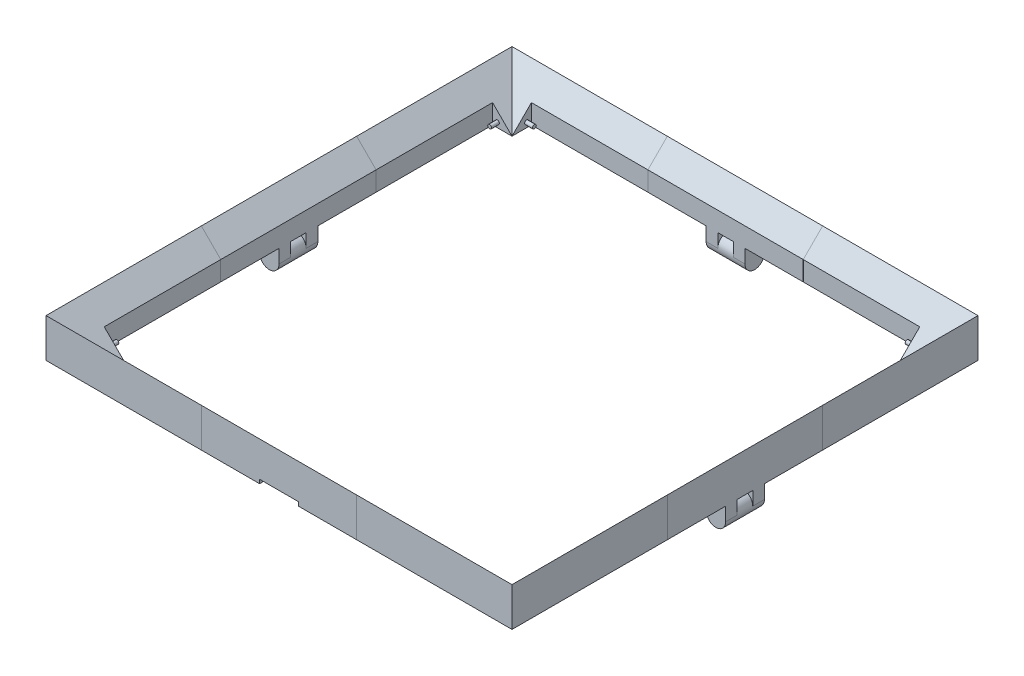
from build123d import *

# Parameters (mm, degrees)
SKETCH1_W                                  = 700
SKETCH1_H                                  = 700
SKETCH1_W_2                                = 500
SKETCH1_H_2                                = 500
BOSS_EXTRUDE2_DEPTH                        = 50
BOSS_EXTRUDE2_DRAFT                        = 45
SKETCH6_W                                  = 700
SKETCH6_H                                  = 700
SKETCH6_W_2                                = 600
SKETCH6_H_2                                = 600
CUT_EXTRUDE1_DEPTH                         = 50
CUT_EXTRUDE2_DEPTH                         = 25
SKETCH8_R                                  = 2.5
BOSS_EXTRUDE3_DEPTH                        = 10
MIRROR1_AT_THE_SECOND_PLANE_COPY_1_SKETC_R = 2.5
MIRROR1_AT_THE_SECOND_PLANE_COPY_1_DEPTH   = 10
MIRROR2_COPY_1_SKETCH_R                    = 2.5
MIRROR2_COPY_1_DEPTH                       = 10
MIRROR2_COPY_2_SKETCH_R                    = 2.5
MIRROR2_COPY_2_DEPTH                       = 10
MIRROR2_COPY_3_SKETCH_R                    = 2.5
MIRROR2_COPY_3_DEPTH                       = 10
SKETCH9_W                                  = 25
SKETCH9_H                                  = 15
BOSS_EXTRUDE4_DEPTH                        = 30
SKETCH11_R                                 = 12.5
BOSS_EXTRUDE5_DEPTH                        = 50
FILLET1_R                                  = 12.5
FILLET1_OF_MIRROR3_R                       = 12.5
MIRROR4_START                              = -25
MIRROR4_OUTLINE_R                          = 12.5
MIRROR4_DEPTH                              = 50
MIRROR4_2_DEPTH                            = 15
MIRROR4_START_2                            = 10
MIRROR4_3_DEPTH                            = 15
INTERSECT1_START                           = -300
INTERSECT1_DEPTH                           = 200
INTERSECT1_2_DEPTH                         = 50
INTERSECT1_START_2                         = -250
INTERSECT1_3_OUTLINE_R                     = 2.5
INTERSECT1_3_DEPTH                         = 10
INTERSECT1_4_DEPTH                         = 200
INTERSECT1_START_3                         = -279.452
INTERSECT1_5_DEPTH                         = 29.452
INTERSECT1_6_OUTLINE_R                     = 2.5
INTERSECT1_6_DEPTH                         = 10
INTERSECT1_7_DEPTH                         = 600
INTERSECT1_8_DEPTH                         = 200
INTERSECT1_START_4                         = 100
INTERSECT1_9_DEPTH                         = 200
INTERSECT1_START_5                         = -100
INTERSECT1_10_DEPTH                        = 200
INTERSECT1_START_6                         = -25
INTERSECT1_11_OUTLINE_R                    = 12.5
INTERSECT1_11_DEPTH                        = 50
INTERSECT1_12_DEPTH                        = 15
INTERSECT1_START_7                         = 10
INTERSECT1_13_DEPTH                        = 15
INTERSECT1_14_DEPTH                        = 200
INTERSECT1_START_8                         = 250
INTERSECT1_15_DEPTH                        = 50
INTERSECT1_START_9                         = 240
INTERSECT1_16_OUTLINE_R                    = 2.5
INTERSECT1_16_DEPTH                        = 10
INTERSECT1_17_DEPTH                        = 200
INTERSECT1_START_10                        = -280.548
INTERSECT1_18_DEPTH                        = 30.548
INTERSECT1_19_OUTLINE_R                    = 2.5
INTERSECT1_19_DEPTH                        = 10
INTERSECT1_20_DEPTH                        = 200
INTERSECT1_21_OUTLINE_R                    = 12.5
INTERSECT1_21_DEPTH                        = 50
INTERSECT1_22_DEPTH                        = 15
INTERSECT1_23_DEPTH                        = 15
INTERSECT1_24_DEPTH                        = 200
INTERSECT1_25_OUTLINE_R                    = 12.5
INTERSECT1_25_DEPTH                        = 50
INTERSECT1_26_DEPTH                        = 15
INTERSECT1_27_DEPTH                        = 15
INTERSECT1_28_DEPTH                        = 200
INTERSECT1_29_DEPTH                        = 50
INTERSECT1_30_OUTLINE_R                    = 2.5
INTERSECT1_30_DEPTH                        = 10
INTERSECT1_31_DEPTH                        = 200
INTERSECT1_32_DEPTH                        = 30.548
INTERSECT1_33_OUTLINE_R                    = 2.5
INTERSECT1_33_DEPTH                        = 10
INTERSECT1_34_DEPTH                        = 200
INTERSECT1_35_DEPTH                        = 50
INTERSECT1_36_OUTLINE_R                    = 2.5
INTERSECT1_36_DEPTH                        = 10
INTERSECT1_37_DEPTH                        = 200
INTERSECT1_38_DEPTH                        = 30.548
INTERSECT1_39_OUTLINE_R                    = 2.5
INTERSECT1_39_DEPTH                        = 10
SKETCH20_W                                 = 50
SKETCH20_H                                 = 35
CUT_EXTRUDE3_DEPTH                         = 100


with BuildPart() as part:
    # Sketch1 → Boss-Extrude2 (with draft: the straight prism first)
    with BuildSketch(Plane(origin=(0, 0, 0), x_dir=(1, 0, 0), z_dir=(0, 1, 0))):
        Rectangle(SKETCH1_W, SKETCH1_H)
        Rectangle(SKETCH1_W_2, SKETCH1_H_2, mode=Mode.SUBTRACT)
    extrude(amount=BOSS_EXTRUDE2_DEPTH)
    # Boss-Extrude2: the draft: its side faces are tilted about the plane it starts from
    boss_extrude2_sides = [part.faces().sort_by_distance(p)[0] for p in [
        (-350, 25, 0),
        (0, 25, 350),
        (350, 25, 0),
        (0, 25, -350),
        (250, 25, 0),
        (0, 25, 250),
        (-250, 25, 0),
        (0, 25, -250),
    ]]
    draft(boss_extrude2_sides, Plane(origin=(0, 0, 0), x_dir=(1, 0, 0), z_dir=(0, 1, 0)), BOSS_EXTRUDE2_DRAFT)

    # Sketch6 → Cut-Extrude1 (cut)
    with BuildSketch(Plane(origin=(0, 50, 0), x_dir=(1, 0, 0), z_dir=(0, 1, 0))):
        Rectangle(SKETCH6_W, SKETCH6_H)
        Rectangle(SKETCH6_W_2, SKETCH6_H_2, mode=Mode.SUBTRACT)
    extrude(amount=-CUT_EXTRUDE1_DEPTH, mode=Mode.SUBTRACT)

    # Sketch7 → Cut-Extrude2 (cut)
    with BuildSketch(Plane.XZ):
        Polygon((-275, 250), (-250, 250), (-250, 275), (250, 275), (250, 250), (275, 250), (275, -250), (250, -250), (250, -275), (-250, -275), (-250, -250), (-275, -250), align=None)
    extrude(amount=-CUT_EXTRUDE2_DEPTH, mode=Mode.SUBTRACT)

    # Sketch8 → Boss-Extrude3 (add)
    with BuildSketch(Plane.XY.offset(-250)):
        with Locations(Location((-268.75, 6.25, 0), (0, 0, 180))):
            Circle(SKETCH8_R)
    boss_extrude3 = extrude(amount=BOSS_EXTRUDE3_DEPTH)

    # Mirror1: Boss-Extrude3 across plane
    add(boss_extrude3.mirror(Plane(origin=(0, 0, 0), x_dir=(0, 0, 1), z_dir=(1, 0, 0))))

    # Mirror1 at the second plane: Boss-Extrude3 across plane
    add(boss_extrude3.mirror(Plane.XY))

    # Mirror1 at the second plane copy 1 sketc → Mirror1 at the second plane copy 1 (add)
    with BuildSketch(Plane(origin=(0, 0, 250), x_dir=(-1, 0, 0), z_dir=(0, 0, -1))):
        with Locations(Location((-268.75, 6.25, 0), (0, 0, 180))):
            Circle(MIRROR1_AT_THE_SECOND_PLANE_COPY_1_SKETC_R)
    extrude(amount=MIRROR1_AT_THE_SECOND_PLANE_COPY_1_DEPTH)

    # Mirror2: Boss-Extrude3 across plane
    add(boss_extrude3.mirror(Plane(origin=(0, 0, 0), x_dir=(0.7071067811865477, 0, 0.7071067811865474), z_dir=(-0.7071067811865474, 0, 0.7071067811865477))))

    # Mirror2 copy 1 sketch → Mirror2 copy 1 (add)
    with BuildSketch(Plane(origin=(-250, 0, 0), x_dir=(0, 0, -1), z_dir=(1, 0, 0))):
        with Locations(Location((-268.75, 6.25, 0), (0, 0, 180))):
            Circle(MIRROR2_COPY_1_SKETCH_R)
    extrude(amount=MIRROR2_COPY_1_DEPTH)

    # Mirror2 copy 2 sketch → Mirror2 copy 2 (add)
    with BuildSketch(Plane.ZY.offset(-250)):
        with Locations(Location((-268.75, 6.25, 0), (0, 0, 180))):
            Circle(MIRROR2_COPY_2_SKETCH_R)
    extrude(amount=MIRROR2_COPY_2_DEPTH)

    # Mirror2 copy 3 sketch → Mirror2 copy 3 (add)
    with BuildSketch(Plane(origin=(250, 0, 0), x_dir=(0, 0, -1), z_dir=(-1, 0, 0))):
        with Locations((-268.75, -6.25)):
            Circle(MIRROR2_COPY_3_SKETCH_R)
    extrude(amount=MIRROR2_COPY_3_DEPTH)

    # Sketch9 → Boss-Extrude4 (add)
    with BuildSketch(Plane.XZ):
        with Locations((-287.5, 17.5)):
            Rectangle(SKETCH9_W, SKETCH9_H)
        with Locations((-287.5, -17.5)):
            Rectangle(SKETCH9_W, SKETCH9_H)
    boss_extrude4 = extrude(amount=BOSS_EXTRUDE4_DEPTH)

    # Sketch11 → Boss-Extrude5 (add)
    with BuildSketch(Plane(origin=(0, 0, -25), x_dir=(-1, 0, 0), z_dir=(0, 0, -1))):
        with Locations((287.5, -17.5)):
            Circle(SKETCH11_R)
    boss_extrude5 = extrude(amount=-BOSS_EXTRUDE5_DEPTH)

    # Fillet1
    fillet1_edges = [part.edges().sort_by_distance(p)[0] for p in [
        (-275, -30, -17.5),
        (-275, -30, 17.5),
        (-300, -30, 17.5),
        (-300, -30, -17.5),
    ]]
    fillet(fillet1_edges, radius=FILLET1_R - 0.0001)  # a hair under: the kernel refuses the full size

    # Mirror3: Boss-Extrude4, Boss-Extrude5 across plane
    add(boss_extrude4.mirror(Plane(origin=(0, 0, 0), x_dir=(0, 0, 1), z_dir=(1, 0, 0))))
    add(boss_extrude5.mirror(Plane(origin=(0, 0, 0), x_dir=(0, 0, 1), z_dir=(1, 0, 0))))

    # Fillet1 of Mirror3
    fillet1_of_mirror3_edges = [part.edges().sort_by_distance(p)[0] for p in [
        (275, -30, -17.5),
        (275, -30, 17.5),
        (300, -30, 17.5),
        (300, -30, -17.5),
    ]]
    fillet(fillet1_of_mirror3_edges, radius=FILLET1_OF_MIRROR3_R - 0.0001)  # a hair under: the kernel refuses the full size



with BuildPart() as body_2:
    # Mirror4: read off the stored shape, not the designer's step
    # Mirror4 outline → Mirror4 (new body)
    with BuildSketch(Plane.YZ.offset(MIRROR4_START)):
        with Locations((-17.5, 287.5)):
            Circle(MIRROR4_OUTLINE_R)
        with Locations((-17.5, -287.5)):
            Circle(MIRROR4_OUTLINE_R)
    extrude(amount=MIRROR4_DEPTH)


with BuildPart() as part_1:
    add(part.part)

    add(body_2.part)  # Mirror4 2 merges body 2
    # Mirror4 2 outline → Mirror4 2 (add)
    with BuildSketch(Plane.YZ.offset(MIRROR4_START)):
        with BuildLine():
            ThreePointArc((-17.5, 300), (-5, 287.5), (-17.5, 275))
            Line((-17.5, 275), (0, 275))
            Line((0, 275), (0, 300))
            Line((0, 300), (-17.5, 300))
        make_face()
        with BuildLine():
            ThreePointArc((-17.5, -275), (-5, -287.5), (-17.5, -300))
            Line((-17.5, -300), (0, -300))
            Line((0, -300), (0, -275))
            Line((0, -275), (-17.5, -275))
        make_face()
    extrude(amount=MIRROR4_2_DEPTH)

    # Mirror4 3 outline → Mirror4 3 (add)
    with BuildSketch(Plane.YZ.offset(MIRROR4_START_2)):
        with BuildLine():
            ThreePointArc((-17.5, 300), (-5, 287.5), (-17.5, 275))
            Line((-17.5, 275), (0, 275))
            Line((0, 275), (0, 300))
            Line((0, 300), (-17.5, 300))
        make_face()
        with BuildLine():
            ThreePointArc((-17.5, -275), (-5, -287.5), (-17.5, -300))
            Line((-17.5, -300), (0, -300))
            Line((0, -300), (0, -275))
            Line((0, -275), (-17.5, -275))
        make_face()
    extrude(amount=MIRROR4_3_DEPTH)

    # Intersect1 7 outline → Intersect1 7 (cut)
    with BuildSketch(Plane.XY.offset(INTERSECT1_START)):
        Polygon((302, 52), (-302, 52), (-302, 0), (-300, 0), (-300, 50), (-275, 25), (-275, -32), (302, -32), align=None)
    extrude(amount=INTERSECT1_7_DEPTH, mode=Mode.SUBTRACT)

    # Intersect1 8 outline → Intersect1 8 (cut)
    with BuildSketch(Plane.XY.offset(INTERSECT1_START)):
        Polygon((-300, 0), (-275, 0), (-275, 25), (-300, 50), align=None)
    extrude(amount=INTERSECT1_8_DEPTH, mode=Mode.SUBTRACT)

    # Intersect1 9 outline → Intersect1 9 (cut)
    with BuildSketch(Plane.XY.offset(INTERSECT1_START_4)):
        Polygon((-300, 0), (-275, 0), (-275, 25), (-300, 50), align=None)
    extrude(amount=INTERSECT1_9_DEPTH, mode=Mode.SUBTRACT)


with BuildPart() as body_2_2:
    # Intersect1: read off the stored shape, not the designer's step
    # Intersect1 outline → Intersect1 (new body)
    with BuildSketch(Plane.YZ.offset(INTERSECT1_START)):
        Polygon((0, -275), (0, -300), (50, -300), (25, -275), align=None)
    extrude(amount=INTERSECT1_DEPTH)

    # Intersect1 2 outline → Intersect1 2 (add)
    with BuildSketch(Plane.YZ.offset(INTERSECT1_START)):
        Polygon((0, -250), (0, -275), (25, -275), align=None)
    extrude(amount=INTERSECT1_2_DEPTH)

    # Intersect1 3 outline → Intersect1 3 (add)
    with BuildSketch(Plane.YZ.offset(INTERSECT1_START_2)):
        with Locations((6.25, -268.75)):
            Circle(INTERSECT1_3_OUTLINE_R)
    extrude(amount=INTERSECT1_3_DEPTH)

    # Intersect1 4 outline → Intersect1 4 (add)
    with BuildSketch(Plane.XY.offset(INTERSECT1_START)):
        Polygon((-275, 25), (-300, 50), (-300, 0), (-275, 0), align=None)
    extrude(amount=INTERSECT1_4_DEPTH)

    # Intersect1 5 outline → Intersect1 5 (add)
    with BuildSketch(Plane.XY.offset(INTERSECT1_START_3)):
        Polygon((-250, 0), (-275, 25), (-275, 0), align=None)
    extrude(amount=INTERSECT1_5_DEPTH)

    # Intersect1 6 outline → Intersect1 6 (add)
    with BuildSketch(Plane.XY.offset(INTERSECT1_START_2)):
        with Locations((-268.75, 6.25)):
            Circle(INTERSECT1_6_OUTLINE_R)
    extrude(amount=INTERSECT1_6_DEPTH)


with BuildPart() as body_3:
    # Intersect1 10 outline → Intersect1 10 (new body)
    with BuildSketch(Plane.YZ.offset(INTERSECT1_START_5)):
        Polygon((0, -275), (0, -300), (50, -300), (25, -275), align=None)
    extrude(amount=INTERSECT1_10_DEPTH)

    # Intersect1 11 outline → Intersect1 11 (add)
    with BuildSketch(Plane.YZ.offset(INTERSECT1_START_6)):
        with Locations((-17.5, -287.5)):
            Circle(INTERSECT1_11_OUTLINE_R)
    extrude(amount=INTERSECT1_11_DEPTH)

    # Intersect1 12 outline → Intersect1 12 (add)
    with BuildSketch(Plane.YZ.offset(INTERSECT1_START_6)):
        with BuildLine():
            Line((-17.5, -300), (0, -300))
            Line((0, -300), (0, -275))
            Line((0, -275), (-17.5, -275))
            ThreePointArc((-17.5, -275), (-5, -287.5), (-17.5, -300))
        make_face()
    extrude(amount=INTERSECT1_12_DEPTH)

    # Intersect1 13 outline → Intersect1 13 (add)
    with BuildSketch(Plane.YZ.offset(INTERSECT1_START_7)):
        with BuildLine():
            Line((-17.5, -300), (0, -300))
            Line((0, -300), (0, -275))
            Line((0, -275), (-17.5, -275))
            ThreePointArc((-17.5, -275), (-5, -287.5), (-17.5, -300))
        make_face()
    extrude(amount=INTERSECT1_13_DEPTH)


with BuildPart() as body_4:
    # Intersect1 14 outline → Intersect1 14 (new body)
    with BuildSketch(Plane.YZ.offset(INTERSECT1_START_4)):
        Polygon((0, -275), (0, -300), (50, -300), (25, -275), align=None)
    extrude(amount=INTERSECT1_14_DEPTH)

    # Intersect1 15 outline → Intersect1 15 (add)
    with BuildSketch(Plane.YZ.offset(INTERSECT1_START_8)):
        Polygon((0, -250), (0, -275), (25, -275), align=None)
    extrude(amount=INTERSECT1_15_DEPTH)

    # Intersect1 16 outline → Intersect1 16 (add)
    with BuildSketch(Plane.YZ.offset(INTERSECT1_START_9)):
        with Locations((6.25, -268.75)):
            Circle(INTERSECT1_16_OUTLINE_R)
    extrude(amount=INTERSECT1_16_DEPTH)

    # Intersect1 17 outline → Intersect1 17 (add)
    with BuildSketch(Plane.XY.offset(INTERSECT1_START)):
        Polygon((275, 0), (300, 0), (300, 50), (275, 25), align=None)
    extrude(amount=INTERSECT1_17_DEPTH)

    # Intersect1 18 outline → Intersect1 18 (add)
    with BuildSketch(Plane.XY.offset(INTERSECT1_START_10)):
        Polygon((250, 0), (275, 0), (275, 25), align=None)
    extrude(amount=INTERSECT1_18_DEPTH)

    # Intersect1 19 outline → Intersect1 19 (add)
    with BuildSketch(Plane.XY.offset(INTERSECT1_START_2)):
        with Locations((268.75, 6.25)):
            Circle(INTERSECT1_19_OUTLINE_R)
    extrude(amount=INTERSECT1_19_DEPTH)


with BuildPart() as body_5:
    # Intersect1 20 outline → Intersect1 20 (new body)
    with BuildSketch(Plane.XY.offset(INTERSECT1_START_5)):
        Polygon((275, 0), (300, 0), (300, 50), (275, 25), align=None)
    extrude(amount=INTERSECT1_20_DEPTH)

    # Intersect1 21 outline → Intersect1 21 (add)
    with BuildSketch(Plane.XY.offset(INTERSECT1_START_6)):
        with Locations((287.5, -17.5)):
            Circle(INTERSECT1_21_OUTLINE_R)
    extrude(amount=INTERSECT1_21_DEPTH)

    # Intersect1 22 outline → Intersect1 22 (add)
    with BuildSketch(Plane.XY.offset(INTERSECT1_START_6)):
        with BuildLine():
            ThreePointArc((275, -17.5), (287.5, -5), (300, -17.5))
            Line((300, -17.5), (300, 0))
            Line((300, 0), (275, 0))
            Line((275, 0), (275, -17.5))
        make_face()
    extrude(amount=INTERSECT1_22_DEPTH)

    # Intersect1 23 outline → Intersect1 23 (add)
    with BuildSketch(Plane.XY.offset(INTERSECT1_START_7)):
        with BuildLine():
            ThreePointArc((275, -17.5), (287.5, -5), (300, -17.5))
            Line((300, -17.5), (300, 0))
            Line((300, 0), (275, 0))
            Line((275, 0), (275, -17.5))
        make_face()
    extrude(amount=INTERSECT1_23_DEPTH)


with BuildPart() as body_6:
    # Intersect1 24 outline → Intersect1 24 (new body)
    with BuildSketch(Plane.YZ.offset(INTERSECT1_START_5)):
        Polygon((50, 300), (0, 300), (0, 275), (25, 275), align=None)
    extrude(amount=INTERSECT1_24_DEPTH)

    # Intersect1 25 outline → Intersect1 25 (add)
    with BuildSketch(Plane.YZ.offset(INTERSECT1_START_6)):
        with Locations((-17.5, 287.5)):
            Circle(INTERSECT1_25_OUTLINE_R)
    extrude(amount=INTERSECT1_25_DEPTH)

    # Intersect1 26 outline → Intersect1 26 (add)
    with BuildSketch(Plane.YZ.offset(INTERSECT1_START_6)):
        with BuildLine():
            ThreePointArc((-17.5, 300), (-5, 287.5), (-17.5, 275))
            Line((-17.5, 275), (0, 275))
            Line((0, 275), (0, 300))
            Line((0, 300), (-17.5, 300))
        make_face()
    extrude(amount=INTERSECT1_26_DEPTH)

    # Intersect1 27 outline → Intersect1 27 (add)
    with BuildSketch(Plane.YZ.offset(INTERSECT1_START_7)):
        with BuildLine():
            ThreePointArc((-17.5, 300), (-5, 287.5), (-17.5, 275))
            Line((-17.5, 275), (0, 275))
            Line((0, 275), (0, 300))
            Line((0, 300), (-17.5, 300))
        make_face()
    extrude(amount=INTERSECT1_27_DEPTH)

    # Sketch20 → Cut-Extrude3 (cut)
    with BuildSketch(Plane.XY.offset(300)):
        with Locations((0, -12.5)):
            Rectangle(SKETCH20_W, SKETCH20_H)
    extrude(amount=-CUT_EXTRUDE3_DEPTH, mode=Mode.SUBTRACT)


with BuildPart() as body_7:
    # Intersect1 28 outline → Intersect1 28 (new body)
    with BuildSketch(Plane.YZ.offset(INTERSECT1_START)):
        Polygon((0, 275), (25, 275), (50, 300), (0, 300), align=None)
    extrude(amount=INTERSECT1_28_DEPTH)

    # Intersect1 29 outline → Intersect1 29 (add)
    with BuildSketch(Plane.YZ.offset(INTERSECT1_START)):
        Polygon((0, 275), (0, 250), (25, 275), align=None)
    extrude(amount=INTERSECT1_29_DEPTH)

    # Intersect1 30 outline → Intersect1 30 (add)
    with BuildSketch(Plane.YZ.offset(INTERSECT1_START_2)):
        with Locations((6.25, 268.75)):
            Circle(INTERSECT1_30_OUTLINE_R)
    extrude(amount=INTERSECT1_30_DEPTH)

    # Intersect1 31 outline → Intersect1 31 (add)
    with BuildSketch(Plane.XY.offset(INTERSECT1_START_4)):
        Polygon((-275, 25), (-300, 50), (-300, 0), (-275, 0), align=None)
    extrude(amount=INTERSECT1_31_DEPTH)

    # Intersect1 32 outline → Intersect1 32 (add)
    with BuildSketch(Plane.XY.offset(INTERSECT1_START_8)):
        Polygon((-250, 0), (-275, 25), (-275, 0), align=None)
    extrude(amount=INTERSECT1_32_DEPTH)

    # Intersect1 33 outline → Intersect1 33 (add)
    with BuildSketch(Plane.XY.offset(INTERSECT1_START_9)):
        with Locations((-268.75, 6.25)):
            Circle(INTERSECT1_33_OUTLINE_R)
    extrude(amount=INTERSECT1_33_DEPTH)


with BuildPart() as body_8:
    # Intersect1 34 outline → Intersect1 34 (new body)
    with BuildSketch(Plane.XY.offset(INTERSECT1_START_4)):
        Polygon((275, 0), (300, 0), (300, 50), (275, 25), align=None)
    extrude(amount=INTERSECT1_34_DEPTH)

    # Intersect1 35 outline → Intersect1 35 (add)
    with BuildSketch(Plane.XY.offset(INTERSECT1_START_8)):
        Polygon((250, 0), (275, 0), (275, 25), align=None)
    extrude(amount=INTERSECT1_35_DEPTH)

    # Intersect1 36 outline → Intersect1 36 (add)
    with BuildSketch(Plane.XY.offset(INTERSECT1_START_9)):
        with Locations((268.75, 6.25)):
            Circle(INTERSECT1_36_OUTLINE_R)
    extrude(amount=INTERSECT1_36_DEPTH)

    # Intersect1 37 outline → Intersect1 37 (add)
    with BuildSketch(Plane.YZ.offset(INTERSECT1_START_4)):
        Polygon((0, 275), (25, 275), (50, 300), (0, 300), align=None)
    extrude(amount=INTERSECT1_37_DEPTH)

    # Intersect1 38 outline → Intersect1 38 (add)
    with BuildSketch(Plane.YZ.offset(INTERSECT1_START_8)):
        Polygon((0, 275), (0, 250), (25, 275), align=None)
    extrude(amount=INTERSECT1_38_DEPTH)

    # Intersect1 39 outline → Intersect1 39 (add)
    with BuildSketch(Plane.YZ.offset(INTERSECT1_START_9)):
        with Locations((6.25, 268.75)):
            Circle(INTERSECT1_39_OUTLINE_R)
    extrude(amount=INTERSECT1_39_DEPTH)


solid = Compound([part_1.part, body_2_2.part, body_3.part, body_4.part, body_5.part, body_6.part, body_7.part, body_8.part])
